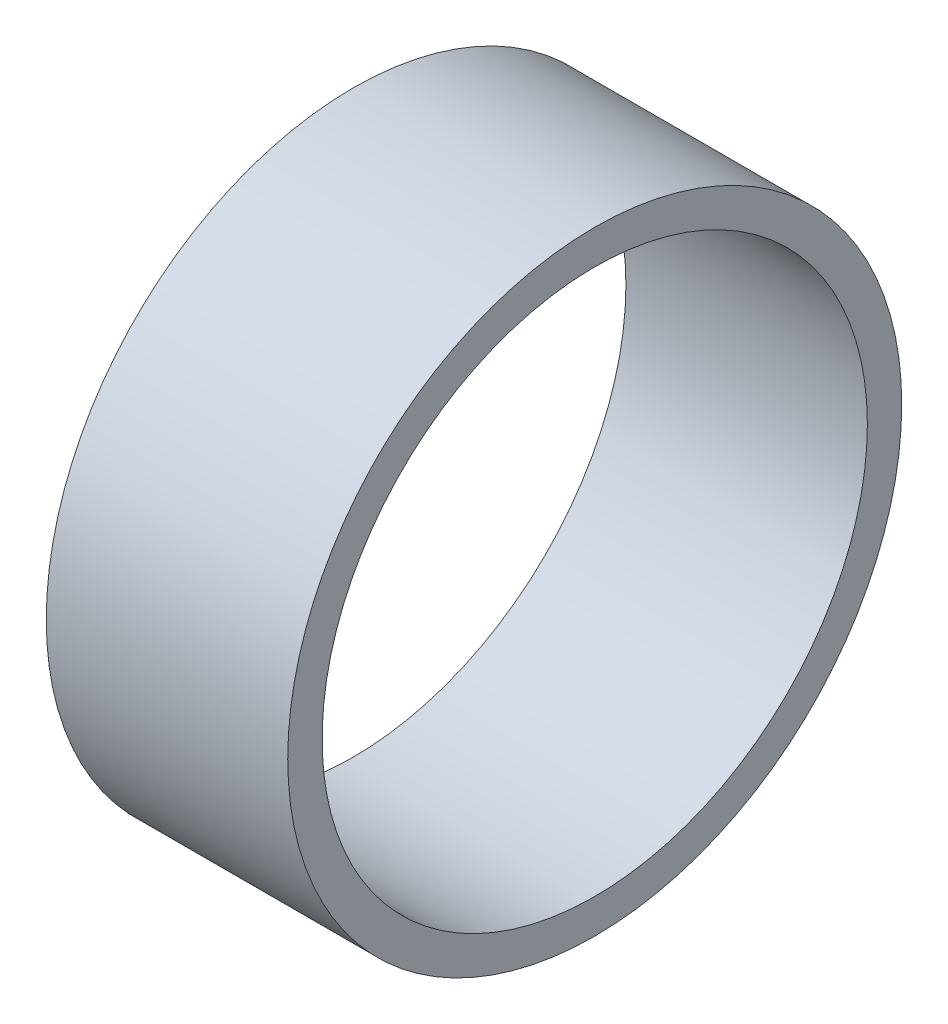
from build123d import *

# Parameters (mm, degrees)
SKETCH1_W = 6.86700003
SKETCH1_H = 0.977250014


with BuildPart() as part:
    # Sketch1 → Revolve1 (revolve)
    with BuildSketch(Plane.XY):
        with Locations((-36.087499985, 8.242624993)):
            Rectangle(SKETCH1_W, SKETCH1_H)
    revolve(axis=Axis((0, 0, 0), (-1, 0, 0)))


solid = part.part
